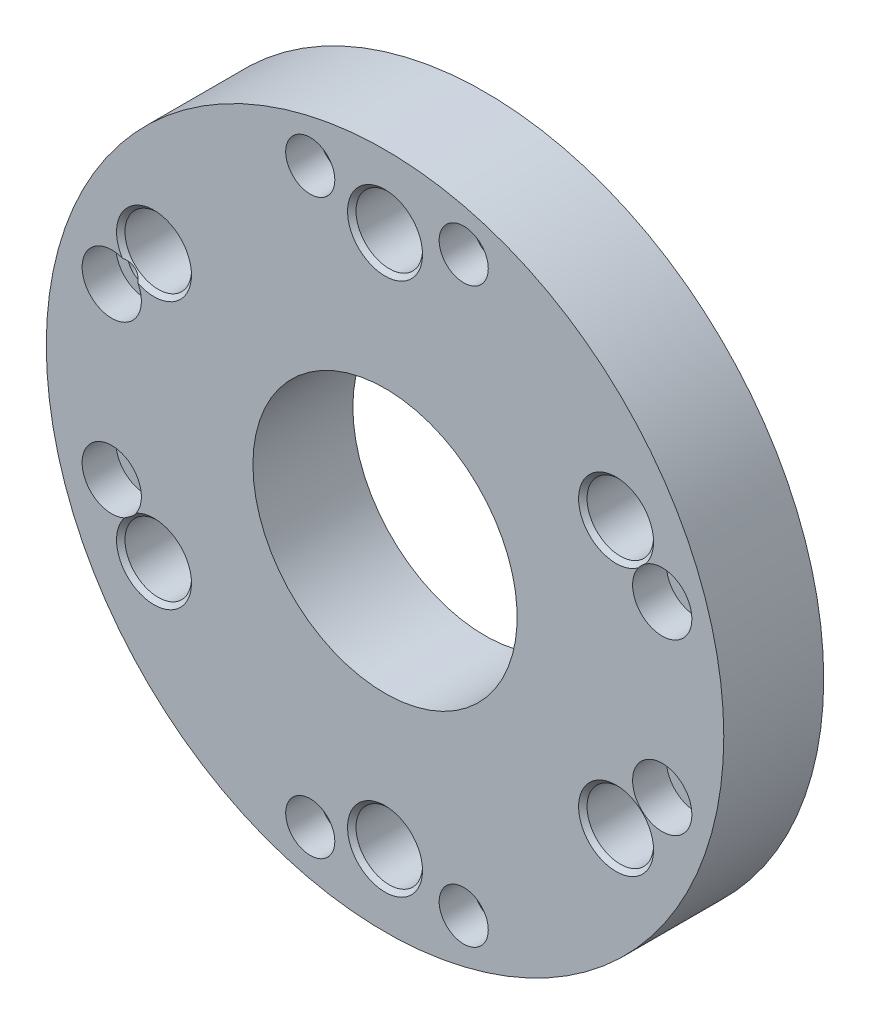
from build123d import *

# Parameters (mm, degrees)
SKETCH_1_R          = 40
EXTRUDE_1_DEPTH     = 11.8
SKETCH_2_R          = 2.15
SKETCH_2_R_2        = 1.75
CUT_EXTRUDE_1_DEPTH = 58.786157512
SKETCH_3_R          = 3.925
SKETCH_3_R_2        = 15.6
CUT_EXTRUDE_2_DEPTH = 58.786157512
SKETCH_5_R          = 2.9
SKETCH_5_R_2        = 3.5
CUT_EXTRUDE_4_DEPTH = 4
CHAMFER_1_SIZE      = 0.5


with BuildPart() as part:
    # 草图1 → 凸台-拉伸1 (new body)
    with BuildSketch(Plane.XY):
        Circle(SKETCH_1_R)
    extrude(amount=EXTRUDE_1_DEPTH)

    # 草图2 → 切除-拉伸1 (cut, through all)
    with BuildSketch(Plane(origin=(0, 0, 0), x_dir=(-1, 0, 0), z_dir=(0, 0, -1))):
        with Locations((-32.730643847, 10.1245665)):
            Circle(SKETCH_2_R)
        with Locations(Location((-32.730643847, -9.8754335, 0), (0, 0, 180))):
            Circle(SKETCH_2_R)
        with Locations((32.269356153, -9.8754335)):
            Circle(SKETCH_2_R)
        with Locations(Location((32.269356153, 10.1245665, 0), (0, 0, 180))):
            Circle(SKETCH_2_R)
        with Locations((-9.290643847, 33.9345665)):
            Circle(SKETCH_2_R_2)
        with Locations(Location((8.829356153, 33.9345665, 0), (0, 0, 180))):
            Circle(SKETCH_2_R_2)
        with Locations((8.829356153, -33.6854335)):
            Circle(SKETCH_2_R_2)
        with Locations(Location((-9.290643847, -33.6854335, 0), (0, 0, 180))):
            Circle(SKETCH_2_R_2)
    extrude(amount=-CUT_EXTRUDE_1_DEPTH, mode=Mode.SUBTRACT)

    # 草图3 → 切除-拉伸2 (cut, through all)
    with BuildSketch(Plane(origin=(0, 0, 0), x_dir=(-1, 0, 0), z_dir=(0, 0, -1))):
        with Locations((0, 31.5)):
            Circle(SKETCH_3_R)
        with Locations((27.279800219, 15.75)):
            Circle(SKETCH_3_R)
        with Locations((27.279800219, -15.75)):
            Circle(SKETCH_3_R)
        with Locations((0, -31.5)):
            Circle(SKETCH_3_R)
        with Locations((-27.279800219, -15.75)):
            Circle(SKETCH_3_R)
        with Locations((-27.279800219, 15.75)):
            Circle(SKETCH_3_R)
        Circle(SKETCH_3_R_2)
    extrude(amount=-CUT_EXTRUDE_2_DEPTH, mode=Mode.SUBTRACT)

    # 草图5 → 切除-拉伸4 (cut)
    with BuildSketch(Plane.XY.offset(11.8)):
        with Locations((-8.829356153, -33.6854335)):
            Circle(SKETCH_5_R)
        with Locations((-8.829356153, 33.9345665)):
            Circle(SKETCH_5_R)
        with Locations((-32.269356153, 10.1245665)):
            Circle(SKETCH_5_R_2)
        with Locations((-32.269356153, -9.8754335)):
            Circle(SKETCH_5_R_2)
        with Locations((9.290643847, 33.9345665)):
            Circle(SKETCH_5_R)
        with Locations((32.730643847, 10.1245665)):
            Circle(SKETCH_5_R_2)
        with Locations((32.730643847, -9.8754335)):
            Circle(SKETCH_5_R_2)
        with Locations((9.290643847, -33.6854335)):
            Circle(SKETCH_5_R)
    extrude(amount=-CUT_EXTRUDE_4_DEPTH, mode=Mode.SUBTRACT)

    # 倒角1
    # the kernel refuses this chamfer: 0.5 mm, written as the material it takes off along each edge
    with BuildSketch(Plane(origin=(0, 31.5, 11.8), x_dir=(-1, 0, 0), z_dir=(0, -1, 0))) as chamfer_1_piece_1:
        Polygon((3.925 + CHAMFER_1_SIZE, 0), (3.925, CHAMFER_1_SIZE), (3.925, 0), align=None)
    revolve(axis=Axis((0, 31.5, 11.8), (0, 0, -1)), mode=Mode.SUBTRACT)
    with BuildSketch(Plane(origin=(0, -31.5, 11.8), x_dir=(-1, 0, 0), z_dir=(0, -1, 0))) as chamfer_1_piece_2:
        Polygon((3.925 + CHAMFER_1_SIZE, 0), (3.925, CHAMFER_1_SIZE), (3.925, 0), align=None)
    revolve(axis=Axis((0, -31.5, 11.8), (0, 0, -1)), mode=Mode.SUBTRACT)
    with BuildSketch(Plane(origin=(-27.279800219, -15.75, 11.8), x_dir=(-1, 0, 0), z_dir=(0, -1, 0))) as chamfer_1_piece_3:
        Polygon((3.925 + CHAMFER_1_SIZE, 0), (3.925, CHAMFER_1_SIZE), (3.925, 0), align=None)
    revolve(axis=Axis((-27.279800219, -15.75, 11.8), (0, 0, -1)), mode=Mode.SUBTRACT)
    with BuildSketch(Plane(origin=(-27.279800219, 15.75, 11.8), x_dir=(-1, 0, 0), z_dir=(0, -1, 0))) as chamfer_1_piece_4:
        Polygon((3.925 + CHAMFER_1_SIZE, 0), (3.925, CHAMFER_1_SIZE), (3.925, 0), align=None)
    revolve(axis=Axis((-27.279800219, 15.75, 11.8), (0, 0, -1)), mode=Mode.SUBTRACT)
    with BuildSketch(Plane(origin=(27.279800219, -15.75, 11.8), x_dir=(-1, 0, 0), z_dir=(0, -1, 0))) as chamfer_1_piece_5:
        Polygon((3.925 + CHAMFER_1_SIZE, 0), (3.925, CHAMFER_1_SIZE), (3.925, 0), align=None)
    revolve(axis=Axis((27.279800219, -15.75, 11.8), (0, 0, -1)), mode=Mode.SUBTRACT)
    with BuildSketch(Plane(origin=(27.279800219, 15.75, 11.8), x_dir=(-1, 0, 0), z_dir=(0, -1, 0))) as chamfer_1_piece_6:
        Polygon((3.925 + CHAMFER_1_SIZE, 0), (3.925, CHAMFER_1_SIZE), (3.925, 0), align=None)
    revolve(axis=Axis((27.279800219, 15.75, 11.8), (0, 0, -1)), mode=Mode.SUBTRACT)


solid = part.part
